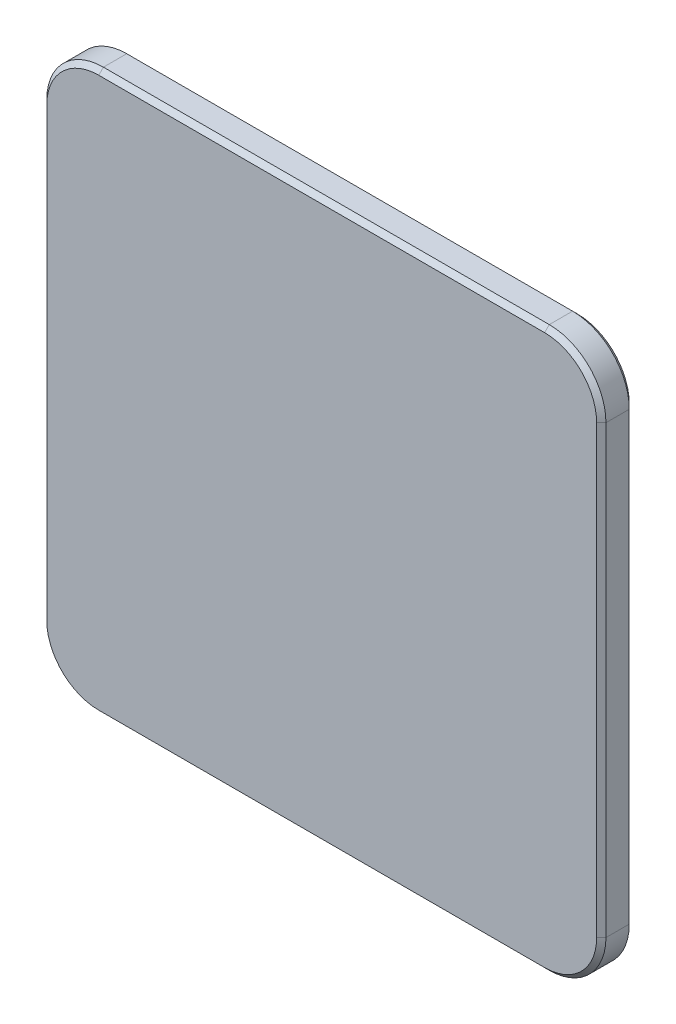
from build123d import *

# Parameters (mm, degrees)
SKETCH3_W                         = 101.6
SKETCH3_H                         = 6.35
BOSS_EXTRUDE1_DEPTH               = 50.8
BASEBORDERRADIUSSKETCH_OUTSIDE_W  = 132.358
BASEBORDERRADIUSSKETCH_OUTSIDE_H  = 132.358
BASEBORDERRADIUSCUT_EXTRUDE_DEPTH = 73.056588277
BASECHAMFER_SIZE                  = 0.79375
BUMPERTHREAD_PITCH                = 0.79375
BUMPERTHREADLPATTERN_COUNT        = 2
BUMPERTHREADLPATTERN_PITCH        = 76.2
BUMPERTHREADLPATTERN_COUNT_DIR2   = 2
BUMPERTHREADLPATTERN_PITCH_DIR2   = 76.2
BUMPERINSETSKETCH_R               = 6.35
BUMPERCUTS_DEPTH                  = 1.5875
LOGOCUTEXTRUDE_DEPTH              = 1.5875


with BuildPart() as part:
    # Sketch3 → Boss-Extrude1 (new, symmetric)
    with BuildSketch(Plane(origin=(0, 0, 0), x_dir=(1, 0, 0), z_dir=(0, 1, 0))):
        Rectangle(SKETCH3_W, SKETCH3_H)
    extrude(amount=BOSS_EXTRUDE1_DEPTH, both=True)

    # FacingBottomSurfaceCut
    split(bisect_by=Plane(origin=(0, 0, -2.778125), x_dir=(1, 0, 0), z_dir=(0, 0, -1)), keep=Keep.BOTTOM)

    # FacingTopSurfaceCut
    split(bisect_by=Plane(origin=(0, 0, 2.778125), x_dir=(-1, 0, 0), z_dir=(0, 0, 1)), keep=Keep.BOTTOM)

    # BaseBorderRadiusSketch outside → BaseBorderRadiusCut-Extrude (cut, through all)
    with BuildSketch(Plane(origin=(0, 0, -2.778125), x_dir=(1, 0, 0), z_dir=(0, 0, -1))):
        Rectangle(BASEBORDERRADIUSSKETCH_OUTSIDE_W, BASEBORDERRADIUSSKETCH_OUTSIDE_H)
        with BuildLine():
            Line((-47.625, 37.973), (-47.625, -37.973))
            ThreePointArc((-47.625, -37.973), (-44.797994652, -44.797994652), (-37.973, -47.625))
            Line((-37.973, -47.625), (37.973, -47.625))
            ThreePointArc((37.973, -47.625), (44.797994652, -44.797994652), (47.625, -37.973))
            Line((47.625, -37.973), (47.625, 37.973))
            ThreePointArc((47.625, 37.973), (44.797994652, 44.797994652), (37.973, 47.625))
            Line((37.973, 47.625), (-37.973, 47.625))
            ThreePointArc((-37.973, 47.625), (-44.797994652, 44.797994652), (-47.625, 37.973))
        make_face(mode=Mode.SUBTRACT)
    extrude(amount=-BASEBORDERRADIUSCUT_EXTRUDE_DEPTH, mode=Mode.SUBTRACT)

    # BaseChamfer
    basechamfer_edges = [part.edges().sort_by_distance(p)[0] for p in [
        (0, -47.625, 2.778125),
        (-44.797994652, -44.797994652, 2.778125),
        (-47.625, 0, 2.778125),
        (-44.797994652, 44.797994652, 2.778125),
        (0, 47.625, 2.778125),
        (44.797994652, 44.797994652, 2.778125),
        (47.625, 0, 2.778125),
        (44.797994652, -44.797994652, 2.778125),
        (-44.797994652, -44.797994652, -2.778125),
        (0, -47.625, -2.778125),
        (44.797994652, -44.797994652, -2.778125),
        (47.625, 0, -2.778125),
        (44.797994652, 44.797994652, -2.778125),
        (0, 47.625, -2.778125),
        (-44.797994652, 44.797994652, -2.778125),
        (-47.625, 0, -2.778125),
    ]]
    chamfer(basechamfer_edges, length=BASECHAMFER_SIZE)

    # Sketch11 → Bumper#6-32 Tapped Hole (revolve, cut)
    with BuildSketch(Plane(origin=(-38.1, 38.1, -2.778125), x_dir=(0, 1, 0), z_dir=(1, 0, 0))):
        Polygon((0, 0), (0, 4.78144403), (1.35255, 3.96875), (1.35255, 0), align=None)
    bumper_6_32_tapped_hole = revolve(axis=Axis((-38.1, 38.1, -9.128125), (0, 0, 1)), mode=Mode.SUBTRACT)

    # BumperThread: the profile of Thread Profile1 profile screwed along a right-hand helix of 6 turns, 8 arcs to a turn; built about Z, then put on its axis
    bumperthread_z = Axis((0, 0, 0), (0, 0, 1))
    bumperthread_corners = [(1.35225, 0, -0.000173205), (1.782179788, 0, 0.248046874), (1.782179788, 0, 0.347265624), (1.35225, 0, 0.595485703)]
    with BuildLine(mode=Mode.PRIVATE) as bumperthread_profile:
        Line(bumperthread_corners[0], bumperthread_corners[1])
        Line(bumperthread_corners[1], bumperthread_corners[2])
        Line(bumperthread_corners[2], bumperthread_corners[3])
        Line(bumperthread_corners[3], bumperthread_corners[0])
    bumperthread_cap = Face(bumperthread_profile.wire())
    bumperthread_turn_angles = [0, 22.5, 45, 67.5, 90, 112.5, 135, 157.5, 180, 202.5, 225, 247.5, 270, 292.5, 315, 337.5, 360]
    bumperthread_turn_weights = [1, 0.9238795325112867, 1, 0.9238795325112867, 1, 0.9238795325112867, 1, 0.9238795325112867, 1, 0.9238795325112867, 1, 0.9238795325112867, 1, 0.9238795325112867, 1, 0.9238795325112867, 1]
    bumperthread_turn_rails = [Edge.make_bspline([Vector(p[0], p[1], 0).rotate(bumperthread_z, bumperthread_turn_angles[k]) / bumperthread_turn_weights[k] + Vector(0, 0, p[2] + BUMPERTHREAD_PITCH * bumperthread_turn_angles[k] / 360) for k in range(17)], [0, 0, 0, 1, 1, 2, 2, 3, 3, 4, 4, 5, 5, 6, 6, 7, 7, 8, 8, 8], 2, bumperthread_turn_weights) for p in bumperthread_corners]
    bumperthread_turn_sides = [Face.make_surface_from_curves(bumperthread_turn_rails[p[0]], bumperthread_turn_rails[p[1]]) for p in [(0, 1), (1, 2), (2, 3), (3, 0)]]
    bumperthread = Plane(origin=(-38.1, 38.1, -3.571875), x_dir=(1, 0, 0), z_dir=(0, 0, 1)) * Solid(Shell([*[p.moved(Location((0, 0, BUMPERTHREAD_PITCH * i))) for i in range(6) for p in bumperthread_turn_sides], bumperthread_cap, bumperthread_cap.rotate(bumperthread_z, 2160).moved(Location((0, 0, BUMPERTHREAD_PITCH * 2160 / 360)))]))
    add(bumperthread, mode=Mode.SUBTRACT)

    # BumperThreadLPattern: Bumper#6-32 Tapped Hole, BumperThread 2 × 2
    with Locations(*[(i * BUMPERTHREADLPATTERN_PITCH, -j * BUMPERTHREADLPATTERN_PITCH_DIR2, 0) for i in range(BUMPERTHREADLPATTERN_COUNT) for j in range(BUMPERTHREADLPATTERN_COUNT_DIR2) if (i, j) != (0, 0)]):
        add(bumper_6_32_tapped_hole, mode=Mode.SUBTRACT)
        add(bumperthread, mode=Mode.SUBTRACT)

    # BumperInsetSketch → BumperCuts (cut)
    with BuildSketch(Plane.XY.offset(-2.778125)):
        with Locations((-38.1, 38.1)):
            Circle(BUMPERINSETSKETCH_R)
        with Locations((38.1, 38.1)):
            Circle(BUMPERINSETSKETCH_R)
        with Locations((38.1, -38.1)):
            Circle(BUMPERINSETSKETCH_R)
        with Locations((-38.1, -38.1)):
            Circle(BUMPERINSETSKETCH_R)
    extrude(amount=BUMPERCUTS_DEPTH, mode=Mode.SUBTRACT)

    # LogoSketch → LogoCutExtrude (cut)
    # profile 1 of 5: a face of its own
    with BuildSketch(Plane.XY.offset(-2.778125)):
        with BuildLine():
            Line((4.533680299, -4.248779361), (-4.533680299, -4.248779361))
            ThreePointArc((-4.533680299, -4.248779361), (-6.217478322, -3.551327384), (-6.914930299, -1.867529361))
            Line((-6.914930299, -1.867529361), (-6.914930299, 1.965294255))
            ThreePointArc((-6.914930299, 1.965294255), (-6.217478322, 3.649092278), (-4.533680299, 4.346544255))
            Line((-4.533680299, 4.346544255), (4.533680299, 4.346544255))
            ThreePointArc((4.533680299, 4.346544255), (6.217478322, 3.649092278), (6.914930299, 1.965294255))
            Line((6.914930299, 1.965294255), (6.914930299, -1.867529361))
            ThreePointArc((6.914930299, -1.867529361), (6.217478322, -3.551327384), (4.533680299, -4.248779361))
        make_face()
        with BuildLine():
            Line((4.533680299, -3.455029361), (-4.533680299, -3.455029361))
            ThreePointArc((-4.533680299, -3.455029361), (-5.656212314, -2.990061376), (-6.121180299, -1.867529361))
            Line((-6.121180299, -1.867529361), (-6.121180299, 1.965294255))
            ThreePointArc((-6.121180299, 1.965294255), (-5.656212314, 3.08782627), (-4.533680299, 3.552794255))
            Line((-4.533680299, 3.552794255), (4.533680299, 3.552794255))
            ThreePointArc((4.533680299, 3.552794255), (5.656212314, 3.08782627), (6.121180299, 1.965294255))
            Line((6.121180299, 1.965294255), (6.121180299, -1.867529361))
            ThreePointArc((6.121180299, -1.867529361), (5.656212314, -2.990061376), (4.533680299, -3.455029361))
        make_face(mode=Mode.SUBTRACT)
    # profile 2 of 5: a face of its own
    with BuildSketch(Plane.XY.offset(-2.778125)):
        with BuildLine():
            Line((-4.084958262, 0.465465281), (-3.745847603, 0.217418406))
            Line((-3.745847603, 0.217418406), (-4.107384418, -0.317411431))
            add(Edge.make_bspline(
                [(-4.107384418, -0.317411431), (-4.117731467, -0.333055261), (-4.136865481, -0.361984212), (-4.158090193, -0.405326), (-4.172527983, -0.444038294), (-4.174461041, -0.469088497), (-4.175342466, -0.480510747)],
                knots=[0, 0, 0, 0, 0.313971844, 0.580604376, 0.808766356, 1, 1, 1, 1], degree=3))
            add(Edge.make_bspline(
                [(-4.175342466, -0.480510747), (-4.174372616, -0.497202362), (-4.172433547, -0.530574757), (-4.154090327, -0.57858004), (-4.125328234, -0.62349711), (-4.087260419, -0.664557891), (-4.042311595, -0.699569508), (-3.993277146, -0.725891806), (-3.94068621, -0.741559074), (-3.904745079, -0.743754394), (-3.886520762, -0.744867553)],
                knots=[0, 0, 0, 0, 0.116072961, 0.232070568, 0.353538763, 0.486654939, 0.620706194, 0.749385024, 0.872923124, 1, 1, 1, 1], degree=3))
            add(Edge.make_bspline(
                [(-3.886520762, -0.744867553), (-3.870661023, -0.743795189), (-3.838879432, -0.74164626), (-3.794253595, -0.720437767), (-3.75207772, -0.689440793), (-3.729786672, -0.660808178), (-3.717984803, -0.645648803)],
                knots=[0, 0, 0, 0, 0.232858362, 0.466628673, 0.717609594, 1, 1, 1, 1], degree=3))
            Line((-3.717984803, -0.645648803), (-3.690122003, -0.606233135))
            Line((-3.690122003, -0.606233135), (-3.153933005, 0.156256163))
            Line((-3.153933005, 0.156256163), (-2.898410745, -0.452647947))
            add(Edge.make_bspline(
                [(-2.898410745, -0.452647947), (-2.888024277, -0.475772536), (-2.86817581, -0.519963461), (-2.831841489, -0.579846527), (-2.791903006, -0.630388935), (-2.748285392, -0.672080262), (-2.701393576, -0.705662229), (-2.649542781, -0.72775488), (-2.594742342, -0.7422332), (-2.556903487, -0.743976214), (-2.53755351, -0.744867553)],
                knots=[0, 0, 0, 0, 0.15358312, 0.29349625, 0.423478163, 0.542965227, 0.6584056, 0.770941816, 0.882864567, 1, 1, 1, 1], degree=3))
            add(Edge.make_bspline(
                [(-2.53755351, -0.744867553), (-2.521871125, -0.743993454), (-2.491251454, -0.742286786), (-2.446927306, -0.731577769), (-2.407120441, -0.711926975), (-2.371562303, -0.686296898), (-2.342444824, -0.654546062), (-2.321085127, -0.618688258), (-2.307125895, -0.579591782), (-2.305807832, -0.552210937), (-2.305136986, -0.538275087)],
                knots=[0, 0, 0, 0, 0.136148641, 0.265828609, 0.392432725, 0.519036841, 0.644259947, 0.763265011, 0.879510543, 1, 1, 1, 1], degree=3))
            add(Edge.make_bspline(
                [(-2.305136986, -0.538275087), (-2.305464465, -0.526906054), (-2.306158645, -0.502806313), (-2.314632812, -0.466165493), (-2.325131743, -0.426317526), (-2.336055885, -0.399980385), (-2.341834332, -0.38604906)],
                knots=[0, 0, 0, 0, 0.216030294, 0.457934648, 0.713268464, 1, 1, 1, 1], degree=3))
            Line((-2.341834332, -0.38604906), (-2.36765839, -0.324886817))
            Line((-2.36765839, -0.324886817), (-3.357127568, 2.071313954))
            Line((-3.357127568, 2.071313954), (-3.382272046, 2.132476197))
            add(Edge.make_bspline(
                [(-3.382272046, 2.132476197), (-3.391301945, 2.152656351), (-3.408656071, 2.191439617), (-3.441527855, 2.243612452), (-3.478610894, 2.287691587), (-3.519221938, 2.324305223), (-3.564704183, 2.351721429), (-3.613147041, 2.372812299), (-3.666498429, 2.384222401), (-3.703211611, 2.385819337), (-3.722062286, 2.386639296)],
                knots=[0, 0, 0, 0, 0.146264449, 0.281098591, 0.406705968, 0.526791125, 0.64127443, 0.756892036, 0.875174279, 1, 1, 1, 1], degree=3))
            add(Edge.make_bspline(
                [(-3.722062286, 2.386639296), (-3.737782144, 2.385906791), (-3.768591504, 2.384471155), (-3.812594616, 2.371678636), (-3.853400851, 2.351552349), (-3.889217265, 2.323149541), (-3.919704575, 2.2898136), (-3.942390739, 2.252085808), (-3.955730991, 2.210603925), (-3.957156452, 2.181726215), (-3.957876712, 2.167134801)],
                knots=[0, 0, 0, 0, 0.131610018, 0.257942557, 0.381164227, 0.511159338, 0.638983625, 0.758259388, 0.877852595, 1, 1, 1, 1], degree=3))
            add(Edge.make_bspline(
                [(-3.957876712, 2.167134801), (-3.957541367, 2.155316969), (-3.956832271, 2.130327859), (-3.948489753, 2.091997072), (-3.937040367, 2.050560236), (-3.926203391, 2.022749847), (-3.920499786, 2.008112969)],
                knots=[0, 0, 0, 0, 0.215420924, 0.455513061, 0.713431243, 1, 1, 1, 1], degree=3))
            Line((-3.920499786, 2.008112969), (-3.893996147, 1.945591565))
            Line((-3.893996147, 1.945591565), (-3.293926584, 0.496725983))
            Line((-3.293926584, 0.496725983), (-3.807689426, 0.876611471))
            add(Edge.make_bspline(
                [(-3.807689426, 0.876611471), (-3.833167937, 0.894380442), (-3.880688749, 0.927521936), (-3.952251465, 0.965833269), (-4.018940223, 0.989482182), (-4.062155899, 0.993152658), (-4.08223994, 0.994858474)],
                knots=[0, 0, 0, 0, 0.306944426, 0.572492185, 0.801320142, 1, 1, 1, 1], degree=3))
            add(Edge.make_bspline(
                [(-4.08223994, 0.994858474), (-4.097731555, 0.994112488), (-4.127593803, 0.992674494), (-4.170220235, 0.980464788), (-4.209105934, 0.961411467), (-4.242723746, 0.934076019), (-4.270541152, 0.901567694), (-4.29170614, 0.865166073), (-4.303484378, 0.824310283), (-4.305026905, 0.796040406), (-4.305821918, 0.781470204)],
                knots=[0, 0, 0, 0, 0.134648954, 0.259554642, 0.38305069, 0.509350284, 0.633866005, 0.7539924, 0.873208487, 1, 1, 1, 1], degree=3))
            add(Edge.make_bspline(
                [(-4.305821918, 0.781470204), (-4.305237015, 0.768756554), (-4.304077979, 0.743563335), (-4.296618286, 0.706042451), (-4.282414772, 0.670042666), (-4.264297503, 0.63434281), (-4.239847705, 0.600402936), (-4.211173134, 0.566547579), (-4.176317414, 0.534273408), (-4.150570297, 0.513988088), (-4.137285959, 0.503521788)],
                knots=[0, 0, 0, 0, 0.113020134, 0.223959355, 0.337996824, 0.455947278, 0.578811618, 0.708729884, 0.849717907, 1, 1, 1, 1], degree=3))
            Line((-4.137285959, 0.503521788), (-4.084958262, 0.465465281))
        make_face()
    # profile 3 of 5: a face of its own
    with BuildSketch(Plane.XY.offset(-2.778125)):
        with BuildLine():
            Line((-2.06932256, 0.569441094), (-1.738366866, -0.222949745))
            Line((-1.738366866, -0.222949745), (-1.991170805, -0.222949745))
            add(Edge.make_bspline(
                [(-1.991170805, -0.222949745), (-2.012261745, -0.223614367), (-2.051967692, -0.224865588), (-2.107932023, -0.233699595), (-2.155042169, -0.250927315), (-2.195039525, -0.273057248), (-2.224928718, -0.304187833), (-2.246605123, -0.341402353), (-2.259854044, -0.385409387), (-2.261026321, -0.416986146), (-2.261643836, -0.433619693)],
                knots=[0, 0, 0, 0, 0.16177683, 0.304562154, 0.432041489, 0.544948255, 0.651814255, 0.758468289, 0.872769429, 1, 1, 1, 1], degree=3))
            add(Edge.make_bspline(
                [(-2.261643836, -0.433619693), (-2.260574247, -0.456848764), (-2.258523163, -0.50139372), (-2.23990385, -0.564493138), (-2.20749446, -0.618690443), (-2.164182697, -0.665039749), (-2.109504243, -0.701011302), (-2.045469958, -0.727369436), (-1.97186017, -0.741707301), (-1.919873825, -0.743780922), (-1.892631635, -0.744867553)],
                knots=[0, 0, 0, 0, 0.127508382, 0.24451496, 0.357276616, 0.471798467, 0.590260399, 0.71421068, 0.850239002, 1, 1, 1, 1], degree=3))
            Line((-1.892631635, -0.744867553), (-1.599052868, -0.744867553))
            add(Edge.make_bspline(
                [(-1.599052868, -0.744867553), (-1.583165866, -0.744339258), (-1.552787886, -0.743329089), (-1.509061489, -0.735828386), (-1.469193378, -0.722861107), (-1.433055447, -0.704675148), (-1.401243716, -0.680875451), (-1.372931876, -0.652810736), (-1.348777237, -0.61903244), (-1.336791698, -0.593539267), (-1.330618579, -0.580409077)],
                knots=[0, 0, 0, 0, 0.141950326, 0.271427171, 0.394991637, 0.515414617, 0.631222228, 0.748611744, 0.870523154, 1, 1, 1, 1], degree=3))
            add(Edge.make_bspline(
                [(-1.330618579, -0.580409077), (-1.303092922, -0.605480247), (-1.25122861, -0.652719773), (-1.165679324, -0.703749184), (-1.082025146, -0.738739646), (-1.025112655, -0.742871759), (-0.997624144, -0.744867553)],
                knots=[0, 0, 0, 0, 0.293088803, 0.552242928, 0.783735081, 1, 1, 1, 1], degree=3))
            Line((-0.997624144, -0.744867553), (-0.73666524, -0.744867553))
            add(Edge.make_bspline(
                [(-0.73666524, -0.744867553), (-0.716019716, -0.744383468), (-0.675693018, -0.743437909), (-0.616768753, -0.734921786), (-0.560723626, -0.721805491), (-0.508201371, -0.701465759), (-0.458248902, -0.677275018), (-0.411437064, -0.646953206), (-0.368243825, -0.610798827), (-0.327860807, -0.570072775), (-0.292228616, -0.524332745), (-0.259885986, -0.47561422), (-0.233475084, -0.422749085), (-0.211603938, -0.366794273), (-0.194817397, -0.307593753), (-0.182236151, -0.245155443), (-0.175845528, -0.179136168), (-0.174606357, -0.133935914), (-0.173972603, -0.110818966)],
                knots=[0, 0, 0, 0, 0.064930069, 0.126827266, 0.186992731, 0.245644302, 0.303664373, 0.361399116, 0.420632584, 0.480616195, 0.541511982, 0.602802836, 0.664329512, 0.727074656, 0.791600441, 0.85772469, 0.927235563, 1, 1, 1, 1], degree=3))
            add(Edge.make_bspline(
                [(-0.173972603, -0.110818966), (-0.174853745, -0.075429905), (-0.176595129, -0.005491134), (-0.191518028, 0.098023373), (-0.215061214, 0.198657112), (-0.248638026, 0.296515713), (-0.29190203, 0.391114188), (-0.343356721, 0.483536359), (-0.406193024, 0.572025717), (-0.476373516, 0.657217042), (-0.552758576, 0.735622045), (-0.632390958, 0.8051105), (-0.715411891, 0.863016182), (-0.800001218, 0.91194452), (-0.888067553, 0.948768136), (-0.978208457, 0.975621002), (-1.071134385, 0.991568411), (-1.133933709, 0.993758366), (-1.165480522, 0.994858474)],
                knots=[0, 0, 0, 0, 0.064899591, 0.128259907, 0.191466009, 0.254289735, 0.317715443, 0.382102007, 0.448052352, 0.516537672, 0.584428982, 0.648666486, 0.710122622, 0.769868617, 0.827606285, 0.884810481, 0.942135329, 1, 1, 1, 1], degree=3))
            add(Edge.make_bspline(
                [(-1.165480522, 0.994858474), (-1.189050512, 0.994275744), (-1.234728607, 0.993146427), (-1.301102062, 0.986191867), (-1.362227976, 0.971930738), (-1.419289185, 0.955184555), (-1.470522442, 0.930757218), (-1.5172642, 0.902185152), (-1.559393603, 0.86830084), (-1.582676766, 0.841203907), (-1.594295805, 0.827681676)],
                knots=[0, 0, 0, 0, 0.148468646, 0.287728801, 0.419248222, 0.543323395, 0.661389628, 0.775404861, 0.887919887, 1, 1, 1, 1], degree=3))
            add(Edge.make_bspline(
                [(-1.594295805, 0.827681676), (-1.603978574, 0.841046504), (-1.622788301, 0.867008988), (-1.654989558, 0.901214706), (-1.689429541, 0.930141794), (-1.725886137, 0.954329991), (-1.765485816, 0.971609185), (-1.806149221, 0.985917655), (-1.849792054, 0.993150595), (-1.879471953, 0.994280087), (-1.894670377, 0.994858474)],
                knots=[0, 0, 0, 0, 0.137870178, 0.267826301, 0.391489649, 0.513356339, 0.632002101, 0.751776058, 0.872889977, 1, 1, 1, 1], degree=3))
            add(Edge.make_bspline(
                [(-1.894670377, 0.994858474), (-1.91081185, 0.994031004), (-1.942392796, 0.992412049), (-1.987686731, 0.981094062), (-2.028207979, 0.960438155), (-2.063799757, 0.933484791), (-2.094147349, 0.901271046), (-2.115350777, 0.863646731), (-2.129238341, 0.822522828), (-2.13051139, 0.793591699), (-2.131164384, 0.778751882)],
                knots=[0, 0, 0, 0, 0.135644011, 0.265388793, 0.388835651, 0.515241477, 0.639201021, 0.757735568, 0.87573386, 1, 1, 1, 1], degree=3))
            add(Edge.make_bspline(
                [(-2.131164384, 0.778751882), (-2.130766664, 0.767848645), (-2.129922918, 0.744717857), (-2.122563038, 0.708742313), (-2.111017026, 0.669831319), (-2.100159415, 0.643649985), (-2.094467038, 0.629923757)],
                knots=[0, 0, 0, 0, 0.211809046, 0.449344558, 0.711304932, 1, 1, 1, 1], degree=3))
            Line((-2.094467038, 0.629923757), (-2.06932256, 0.569441094))
        make_face()
        with BuildLine():
            Line((-0.905880779, -0.222949745), (-0.96364512, -0.222949745))
            add(Edge.make_bspline(
                [(-0.96364512, -0.222949745), (-0.978168715, -0.222631321), (-1.006257308, -0.222015491), (-1.046542144, -0.215250122), (-1.082856532, -0.203636622), (-1.115573692, -0.187899456), (-1.144213283, -0.167355858), (-1.169239162, -0.142515717), (-1.189910289, -0.112673514), (-1.20024359, -0.090381691), (-1.205575771, -0.078878683)],
                knots=[0, 0, 0, 0, 0.144708006, 0.279864879, 0.405576864, 0.523759235, 0.640333608, 0.755321861, 0.873741395, 1, 1, 1, 1], degree=3))
            Line((-1.205575771, -0.078878683), (-1.36052012, 0.29353142))
            add(Edge.make_bspline(
                [(-1.36052012, 0.29353142), (-1.369777667, 0.315635982), (-1.386241975, 0.354948378), (-1.390094496, 0.39731234), (-1.391780822, 0.415855906)],
                knots=[0, 0, 0, 0, 0.562279724, 1, 1, 1, 1], degree=3))
            add(Edge.make_bspline(
                [(-1.391780822, 0.415855906), (-1.390857163, 0.425219907), (-1.388993846, 0.444110115), (-1.377909266, 0.47183204), (-1.356678602, 0.495466214), (-1.330565365, 0.517717391), (-1.298937187, 0.536561401), (-1.263278599, 0.550051131), (-1.224544811, 0.558530079), (-1.197692844, 0.559451328), (-1.183829195, 0.559926967)],
                knots=[0, 0, 0, 0, 0.101322931, 0.204401009, 0.315545453, 0.440468581, 0.574243888, 0.710477244, 0.850519636, 1, 1, 1, 1], degree=3))
            add(Edge.make_bspline(
                [(-1.183829195, 0.559926967), (-1.169736633, 0.559450995), (-1.141274926, 0.558489708), (-1.099067233, 0.549064601), (-1.057314148, 0.534778211), (-1.015881853, 0.514546017), (-0.974746438, 0.488722047), (-0.933609884, 0.457288239), (-0.893723108, 0.419390912), (-0.841383034, 0.363799258), (-0.784852133, 0.288869668), (-0.734154155, 0.194150844), (-0.702006333, 0.097135807), (-0.697915125, 0.031216543), (-0.695890411, -0.001406509)],
                knots=[0, 0, 0, 0, 0.052308876, 0.10564437, 0.159960995, 0.216068651, 0.276577223, 0.340231538, 0.408142326, 0.480813116, 0.623943112, 0.75538574, 0.87894186, 1, 1, 1, 1], degree=3))
            add(Edge.make_bspline(
                [(-0.695890411, -0.001406509), (-0.69654243, -0.018666283), (-0.697780402, -0.05143701), (-0.706927651, -0.097342093), (-0.723095962, -0.136599969), (-0.747187422, -0.168379045), (-0.777721168, -0.193232977), (-0.814823848, -0.211332767), (-0.85848378, -0.221216562), (-0.889521748, -0.222351538), (-0.905880779, -0.222949745)],
                knots=[0, 0, 0, 0, 0.147961661, 0.280931323, 0.399290449, 0.508857407, 0.619299198, 0.733982228, 0.859791306, 1, 1, 1, 1], degree=3))
        make_face(mode=Mode.SUBTRACT)
    # profile 4 of 5: a face of its own
    with BuildSketch(Plane.XY.offset(-2.778125)):
        with BuildLine():
            Line((2.50833155, -1.894717724), (1.397217466, 0.791663911))
            add(Edge.make_bspline(
                [(1.397217466, 0.791663911), (1.389925601, 0.807732566), (1.375798676, 0.838863241), (1.348515852, 0.880704416), (1.316850312, 0.91572422), (1.281770199, 0.944867184), (1.242610268, 0.967719113), (1.199020125, 0.983188327), (1.151862068, 0.992899371), (1.119091349, 0.994194207), (1.102279538, 0.994858474)],
                knots=[0, 0, 0, 0, 0.138219588, 0.267780289, 0.389766178, 0.507112312, 0.624094956, 0.743215423, 0.86826612, 1, 1, 1, 1], degree=3))
            add(Edge.make_bspline(
                [(1.102279538, 0.994858474), (1.079160683, 0.993135457), (1.033739993, 0.989750314), (0.969556035, 0.963361418), (0.913920845, 0.918657584), (0.886348355, 0.879027153), (0.871901755, 0.858262798)],
                knots=[0, 0, 0, 0, 0.246973932, 0.48521981, 0.73028104, 1, 1, 1, 1], degree=3))
            add(Edge.make_bspline(
                [(0.871901755, 0.858262798), (0.844768465, 0.879348197), (0.790744969, 0.921330092), (0.696280719, 0.963956815), (0.593541964, 0.98995192), (0.522081067, 0.993188828), (0.485220462, 0.994858474)],
                knots=[0, 0, 0, 0, 0.245438029, 0.488677192, 0.736252012, 1, 1, 1, 1], degree=3))
            add(Edge.make_bspline(
                [(0.485220462, 0.994858474), (0.46594087, 0.994339041), (0.428108969, 0.99331977), (0.372617776, 0.985211606), (0.320377392, 0.970686118), (0.270457212, 0.951640283), (0.223762422, 0.926392169), (0.179606516, 0.895747944), (0.139817817, 0.858202807), (0.101457189, 0.817305492), (0.067893467, 0.770852479), (0.037723503, 0.721261097), (0.012520096, 0.667942438), (-0.007827676, 0.610967127), (-0.024193619, 0.550557225), (-0.035583362, 0.48643375), (-0.042541095, 0.418956752), (-0.043171115, 0.372833145), (-0.043493151, 0.349257019)],
                knots=[0, 0, 0, 0, 0.061714308, 0.121100569, 0.178984271, 0.235011739, 0.291794542, 0.348535646, 0.406541893, 0.466597514, 0.527811202, 0.5896277, 0.652238918, 0.716245913, 0.783098682, 0.852377908, 0.924542825, 1, 1, 1, 1], degree=3))
            add(Edge.make_bspline(
                [(-0.043493151, 0.349257019), (-0.04249627, 0.304578621), (-0.040541119, 0.216952343), (-0.023787126, 0.08865808), (0.003050526, -0.033412166), (0.041521572, -0.14923051), (0.090206432, -0.258674998), (0.150193931, -0.361779856), (0.220532598, -0.458881458), (0.275901829, -0.517116748), (0.303772474, -0.546430053)],
                knots=[0, 0, 0, 0, 0.13575741, 0.266256558, 0.392548012, 0.515136191, 0.636574194, 0.755972731, 0.87716648, 1, 1, 1, 1], degree=3))
            add(Edge.make_bspline(
                [(0.303772474, -0.546430053), (0.322712792, -0.564231109), (0.359224281, -0.598546431), (0.417494541, -0.642694543), (0.476802012, -0.677571995), (0.538706226, -0.704677319), (0.607415277, -0.723146956), (0.686008312, -0.735356931), (0.776362173, -0.743601454), (0.840620238, -0.744429449), (0.874620077, -0.744867553)],
                knots=[0, 0, 0, 0, 0.124849688, 0.240674322, 0.350453258, 0.454797631, 0.564403721, 0.691286987, 0.836655633, 1, 1, 1, 1], degree=3))
            add(Edge.make_bspline(
                [(0.874620077, -0.744867553), (0.91019889, -0.744582603), (0.975529032, -0.744059376), (1.064440999, -0.737901296), (1.135837562, -0.729567328), (1.192736788, -0.715256338), (1.240518653, -0.692323153), (1.284957916, -0.659817354), (1.330687462, -0.618241194), (1.359078202, -0.585064725), (1.374111729, -0.567497048)],
                knots=[0, 0, 0, 0, 0.191899311, 0.352367264, 0.48060847, 0.579323834, 0.667329523, 0.764643085, 0.875373281, 1, 1, 1, 1], degree=3))
            Line((1.374111729, -0.567497048), (1.976899615, -2.011605567))
            add(Edge.make_bspline(
                [(1.976899615, -2.011605567), (1.987499405, -2.035192476), (2.007773353, -2.080306554), (2.0448964, -2.141289455), (2.084789378, -2.193502327), (2.128646393, -2.236560548), (2.176721868, -2.269727775), (2.228582091, -2.292969924), (2.283899339, -2.308124201), (2.322252292, -2.309777067), (2.341834332, -2.310620978)],
                knots=[0, 0, 0, 0, 0.154199472, 0.29493339, 0.425004058, 0.545467284, 0.660211577, 0.771536168, 0.88335219, 1, 1, 1, 1], degree=3))
            add(Edge.make_bspline(
                [(2.341834332, -2.310620978), (2.356848108, -2.309779646), (2.385929718, -2.308149989), (2.428140366, -2.29705408), (2.466316789, -2.277504005), (2.500902934, -2.252078036), (2.529368058, -2.220790099), (2.551023666, -2.18598306), (2.563822282, -2.147470978), (2.565331864, -2.120883046), (2.56609589, -2.107426414)],
                knots=[0, 0, 0, 0, 0.134228615, 0.260000177, 0.386811191, 0.515628199, 0.641790559, 0.762672354, 0.879884203, 1, 1, 1, 1], degree=3))
            add(Edge.make_bspline(
                [(2.56609589, -2.107426414), (2.565344351, -2.094008269), (2.563669049, -2.064097054), (2.55134191, -2.015300743), (2.532957439, -1.957770135), (2.516967991, -1.916830569), (2.50833155, -1.894717724)],
                knots=[0, 0, 0, 0, 0.181669741, 0.404971235, 0.678604841, 1, 1, 1, 1], degree=3))
        make_face()
        with BuildLine():
            Line((1.036360231, 0.252756591), (1.186547517, -0.10334358))
            add(Edge.make_bspline(
                [(1.186547517, -0.10334358), (1.177644504, -0.119223421), (1.161132053, -0.148675822), (1.132663675, -0.186035017), (1.106828316, -0.215993146), (1.079262458, -0.237958148), (1.047083776, -0.250719862), (1.009707659, -0.260409067), (0.964894053, -0.265212603), (0.932617412, -0.266014833), (0.915394906, -0.266442896)],
                knots=[0, 0, 0, 0, 0.16021322, 0.297148058, 0.413026578, 0.50844475, 0.604113145, 0.715467648, 0.848176265, 1, 1, 1, 1], degree=3))
            add(Edge.make_bspline(
                [(0.915394906, -0.266442896), (0.889579781, -0.265207436), (0.840036625, -0.2628364), (0.770745011, -0.238945607), (0.709158931, -0.202281411), (0.678261533, -0.166396186), (0.662590967, -0.148195892)],
                knots=[0, 0, 0, 0, 0.266721268, 0.511878737, 0.752434302, 1, 1, 1, 1], degree=3))
            add(Edge.make_bspline(
                [(0.662590967, -0.148195892), (0.647776108, -0.128483426), (0.618716677, -0.089817311), (0.581290004, -0.029066358), (0.550050826, 0.032220573), (0.524143627, 0.09352841), (0.503122377, 0.155149794), (0.489351459, 0.217637028), (0.479811132, 0.280326718), (0.478885436, 0.322265263), (0.478424658, 0.343140795)],
                knots=[0, 0, 0, 0, 0.138360254, 0.27139443, 0.399915976, 0.524138605, 0.644769002, 0.764761049, 0.882906328, 1, 1, 1, 1], degree=3))
            add(Edge.make_bspline(
                [(0.478424658, 0.343140795), (0.47906884, 0.360171728), (0.480282853, 0.392267847), (0.489378746, 0.437127616), (0.5060132, 0.475216425), (0.529480931, 0.506466852), (0.559713313, 0.531147602), (0.59687428, 0.548119073), (0.640309168, 0.558256602), (0.671366309, 0.559350442), (0.687735445, 0.559926967)],
                knots=[0, 0, 0, 0, 0.147927924, 0.278781681, 0.395077221, 0.506073335, 0.61518668, 0.730512376, 0.857962468, 1, 1, 1, 1], degree=3))
            add(Edge.make_bspline(
                [(0.687735445, 0.559926967), (0.706385369, 0.55921231), (0.742530766, 0.557827233), (0.794706672, 0.545046413), (0.842596735, 0.524469362), (0.887115679, 0.496258103), (0.926491325, 0.459036484), (0.961613275, 0.41371671), (0.992817472, 0.360679222), (1.009407132, 0.321386466), (1.018011558, 0.301006805)],
                knots=[0, 0, 0, 0, 0.124290436, 0.240887161, 0.356014472, 0.470913287, 0.590709802, 0.715605508, 0.852495372, 1, 1, 1, 1], degree=3))
            add(Edge.make_bspline(
                [(1.018011558, 0.301006805), (1.021429912, 0.292180026), (1.027644132, 0.27613384), (1.03365559, 0.260010645), (1.036360231, 0.252756591)],
                knots=[0, 0, 0, 0, 0.55008578, 1, 1, 1, 1], degree=3))
        make_face(mode=Mode.SUBTRACT)
    # profile 5 of 5: a face of its own
    with BuildSketch(Plane.XY.offset(-2.778125)):
        with BuildLine():
            Line((4.552509632, -1.894717724), (3.441395548, 0.791663911))
            add(Edge.make_bspline(
                [(3.441395548, 0.791663911), (3.434103683, 0.807732566), (3.419976758, 0.838863241), (3.392693934, 0.880704416), (3.361028395, 0.91572422), (3.325948281, 0.944867184), (3.286788351, 0.967719113), (3.243198207, 0.983188327), (3.19604015, 0.992899371), (3.163269431, 0.994194207), (3.14645762, 0.994858474)],
                knots=[0, 0, 0, 0, 0.138219588, 0.267780289, 0.389766178, 0.507112312, 0.624094956, 0.743215423, 0.86826612, 1, 1, 1, 1], degree=3))
            add(Edge.make_bspline(
                [(3.14645762, 0.994858474), (3.123338765, 0.993135457), (3.077918075, 0.989750314), (3.013734117, 0.963361418), (2.958098927, 0.918657584), (2.930526437, 0.879027153), (2.916079837, 0.858262798)],
                knots=[0, 0, 0, 0, 0.246973932, 0.48521981, 0.73028104, 1, 1, 1, 1], degree=3))
            add(Edge.make_bspline(
                [(2.916079837, 0.858262798), (2.888946547, 0.879348197), (2.834923051, 0.921330092), (2.740458801, 0.963956815), (2.637720046, 0.98995192), (2.566259149, 0.993188828), (2.529398545, 0.994858474)],
                knots=[0, 0, 0, 0, 0.245438029, 0.488677192, 0.736252012, 1, 1, 1, 1], degree=3))
            add(Edge.make_bspline(
                [(2.529398545, 0.994858474), (2.510118952, 0.994339041), (2.472287051, 0.99331977), (2.416795858, 0.985211606), (2.364555474, 0.970686118), (2.314635294, 0.951640283), (2.267940504, 0.926392169), (2.223784598, 0.895747944), (2.183995899, 0.858202807), (2.145635271, 0.817305492), (2.112071549, 0.770852479), (2.081901585, 0.721261097), (2.056698179, 0.667942438), (2.036350406, 0.610967127), (2.019984463, 0.550557225), (2.00859472, 0.48643375), (2.001636987, 0.418956752), (2.001006967, 0.372833145), (2.000684932, 0.349257019)],
                knots=[0, 0, 0, 0, 0.061714308, 0.121100569, 0.178984271, 0.235011739, 0.291794542, 0.348535646, 0.406541893, 0.466597514, 0.527811202, 0.5896277, 0.652238918, 0.716245913, 0.783098682, 0.852377908, 0.924542825, 1, 1, 1, 1], degree=3))
            add(Edge.make_bspline(
                [(2.000684932, 0.349257019), (2.001681813, 0.304578621), (2.003636963, 0.216952343), (2.020390956, 0.08865808), (2.047228608, -0.033412166), (2.085699654, -0.14923051), (2.134384514, -0.258674998), (2.194372013, -0.361779856), (2.26471068, -0.458881458), (2.320079911, -0.517116748), (2.347950557, -0.546430053)],
                knots=[0, 0, 0, 0, 0.13575741, 0.266256558, 0.392548012, 0.515136191, 0.636574194, 0.755972731, 0.87716648, 1, 1, 1, 1], degree=3))
            add(Edge.make_bspline(
                [(2.347950557, -0.546430053), (2.366890874, -0.564231109), (2.403402364, -0.598546431), (2.461672623, -0.642694543), (2.520980094, -0.677571995), (2.582884308, -0.704677319), (2.651593359, -0.723146956), (2.730186395, -0.735356931), (2.820540255, -0.743601454), (2.88479832, -0.744429449), (2.918798159, -0.744867553)],
                knots=[0, 0, 0, 0, 0.124849688, 0.240674322, 0.350453258, 0.454797631, 0.564403721, 0.691286987, 0.836655633, 1, 1, 1, 1], degree=3))
            add(Edge.make_bspline(
                [(2.918798159, -0.744867553), (2.954376973, -0.744582603), (3.019707114, -0.744059376), (3.108619081, -0.737901296), (3.180015644, -0.729567328), (3.23691487, -0.715256338), (3.284696735, -0.692323153), (3.329135999, -0.659817354), (3.374865545, -0.618241194), (3.403256284, -0.585064725), (3.418289812, -0.567497048)],
                knots=[0, 0, 0, 0, 0.191899311, 0.352367264, 0.48060847, 0.579323834, 0.667329523, 0.764643085, 0.875373281, 1, 1, 1, 1], degree=3))
            Line((3.418289812, -0.567497048), (4.021077697, -2.011605567))
            add(Edge.make_bspline(
                [(4.021077697, -2.011605567), (4.031677487, -2.035192476), (4.051951436, -2.080306554), (4.089074482, -2.141289455), (4.12896746, -2.193502327), (4.172824475, -2.236560548), (4.22089995, -2.269727775), (4.272760173, -2.292969924), (4.328077421, -2.308124201), (4.366430374, -2.309777067), (4.386012414, -2.310620978)],
                knots=[0, 0, 0, 0, 0.154199472, 0.29493339, 0.425004058, 0.545467284, 0.660211577, 0.771536168, 0.88335219, 1, 1, 1, 1], degree=3))
            add(Edge.make_bspline(
                [(4.386012414, -2.310620978), (4.40102619, -2.309779646), (4.4301078, -2.308149989), (4.472318448, -2.29705408), (4.510494872, -2.277504005), (4.545081016, -2.252078036), (4.57354614, -2.220790099), (4.595201748, -2.18598306), (4.608000364, -2.147470978), (4.609509946, -2.120883046), (4.610273973, -2.107426414)],
                knots=[0, 0, 0, 0, 0.134228615, 0.260000177, 0.386811191, 0.515628199, 0.641790559, 0.762672354, 0.879884203, 1, 1, 1, 1], degree=3))
            add(Edge.make_bspline(
                [(4.610273973, -2.107426414), (4.609522433, -2.094008269), (4.607847131, -2.064097054), (4.595519992, -2.015300743), (4.577135521, -1.957770135), (4.561146073, -1.916830569), (4.552509632, -1.894717724)],
                knots=[0, 0, 0, 0, 0.181669741, 0.404971235, 0.678604841, 1, 1, 1, 1], degree=3))
        make_face()
        with BuildLine():
            Line((3.080538313, 0.252756591), (3.230725599, -0.10334358))
            add(Edge.make_bspline(
                [(3.230725599, -0.10334358), (3.221822587, -0.119223421), (3.205310136, -0.148675822), (3.176841758, -0.186035017), (3.151006398, -0.215993146), (3.123440541, -0.237958148), (3.091261858, -0.250719862), (3.053885741, -0.260409067), (3.009072135, -0.265212603), (2.976795494, -0.266014833), (2.959572988, -0.266442896)],
                knots=[0, 0, 0, 0, 0.16021322, 0.297148058, 0.413026578, 0.50844475, 0.604113145, 0.715467648, 0.848176265, 1, 1, 1, 1], degree=3))
            add(Edge.make_bspline(
                [(2.959572988, -0.266442896), (2.933757863, -0.265207436), (2.884214707, -0.2628364), (2.814923093, -0.238945607), (2.753337014, -0.202281411), (2.722439615, -0.166396186), (2.70676905, -0.148195892)],
                knots=[0, 0, 0, 0, 0.266721268, 0.511878737, 0.752434302, 1, 1, 1, 1], degree=3))
            add(Edge.make_bspline(
                [(2.70676905, -0.148195892), (2.69195419, -0.128483426), (2.662894759, -0.089817311), (2.625468087, -0.029066358), (2.594228908, 0.032220573), (2.568321709, 0.09352841), (2.547300459, 0.155149794), (2.533529542, 0.217637028), (2.523989215, 0.280326718), (2.523063519, 0.322265263), (2.52260274, 0.343140795)],
                knots=[0, 0, 0, 0, 0.138360254, 0.27139443, 0.399915976, 0.524138605, 0.644769002, 0.764761049, 0.882906328, 1, 1, 1, 1], degree=3))
            add(Edge.make_bspline(
                [(2.52260274, 0.343140795), (2.523246923, 0.360171728), (2.524460936, 0.392267847), (2.533556828, 0.437127616), (2.550191282, 0.475216425), (2.573659013, 0.506466852), (2.603891395, 0.531147602), (2.641052363, 0.548119073), (2.68448725, 0.558256602), (2.715544391, 0.559350442), (2.731913527, 0.559926967)],
                knots=[0, 0, 0, 0, 0.147927924, 0.278781681, 0.395077221, 0.506073335, 0.61518668, 0.730512376, 0.857962468, 1, 1, 1, 1], degree=3))
            add(Edge.make_bspline(
                [(2.731913527, 0.559926967), (2.750563451, 0.55921231), (2.786708848, 0.557827233), (2.838884754, 0.545046413), (2.886774817, 0.524469362), (2.931293761, 0.496258103), (2.970669407, 0.459036484), (3.005791357, 0.41371671), (3.036995555, 0.360679222), (3.053585214, 0.321386466), (3.06218964, 0.301006805)],
                knots=[0, 0, 0, 0, 0.124290436, 0.240887161, 0.356014472, 0.470913287, 0.590709802, 0.715605508, 0.852495372, 1, 1, 1, 1], degree=3))
            add(Edge.make_bspline(
                [(3.06218964, 0.301006805), (3.065607994, 0.292180026), (3.071822214, 0.27613384), (3.077833673, 0.260010645), (3.080538313, 0.252756591)],
                knots=[0, 0, 0, 0, 0.55008578, 1, 1, 1, 1], degree=3))
        make_face(mode=Mode.SUBTRACT)
    extrude(amount=LOGOCUTEXTRUDE_DEPTH, mode=Mode.SUBTRACT)


solid = part.part
